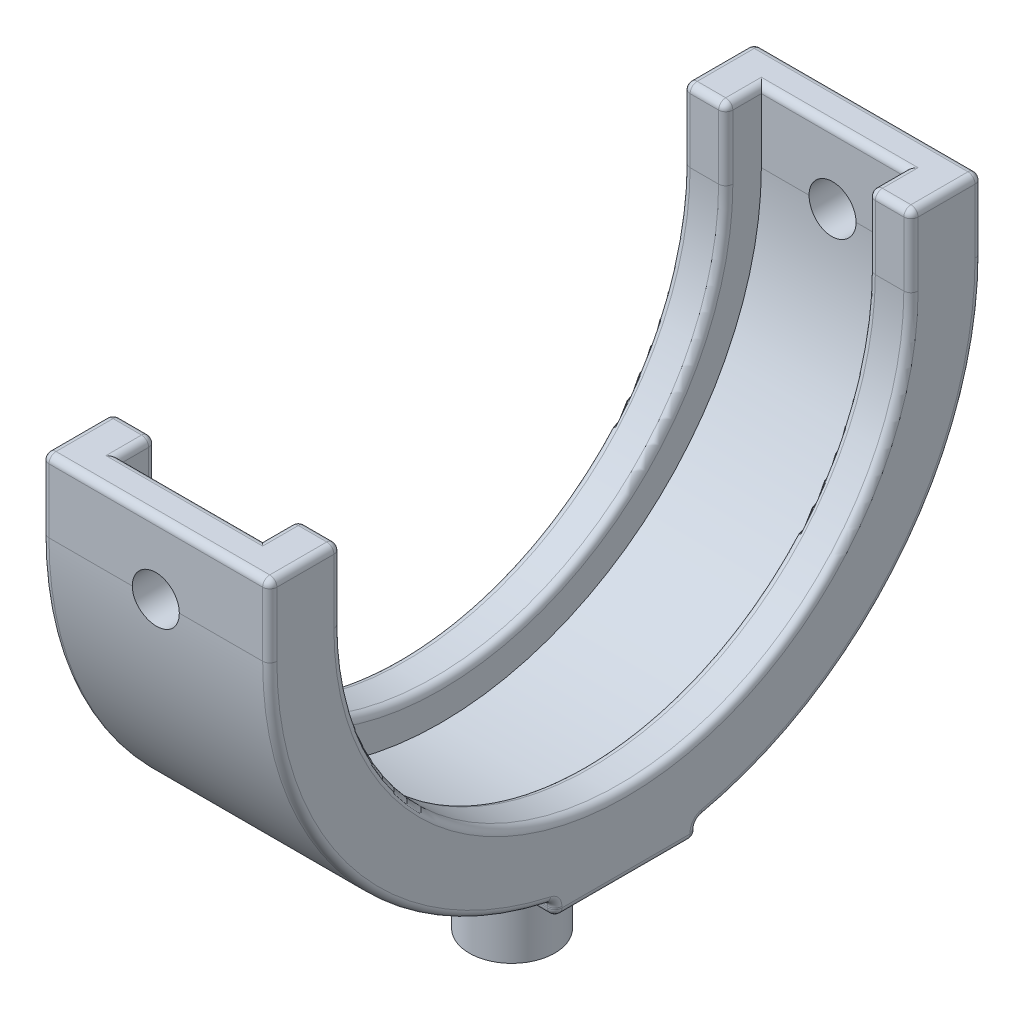
from build123d import *

# Parameters (mm, degrees)
BOSS_EXTRUDE1_DEPTH = 16
SKETCH4_R           = 2.999999999999999
BOSS_EXTRUDE2_DEPTH = 7
BOSS_EXTRUDE3_DEPTH = 5
SKETCH19_R          = 1.6500000000000006
CUT_EXTRUDE1_DEPTH  = 62.74073500409036
FILLET3_R           = 0.5
FILLET5_R           = 0.5
FILLET6_R           = 0.5


with BuildPart() as part:
    # Sketch1 → Boss-Extrude1 (new body)
    with BuildSketch(Plane(origin=(0, 0, 0), x_dir=(0, 0, -1), z_dir=(1, 0, 0))):
        with BuildLine():
            Line((-25, 0), (25, 0))
            ThreePointArc((25, 0), (19.364916731037084, -15.811388300841896), (4.999999999999999, -24.49489742783178))
            Line((4.999999999999999, -24.49489742783178), (5, -25.494897427831784))
            Line((5, -25.494897427831784), (-5, -25.494897427831784))
            Line((-5, -25.494897427831784), (-4.999999999999999, -24.49489742783178))
            ThreePointArc((-4.999999999999999, -24.49489742783178), (-19.364916731037088, -15.811388300841891), (-25, 0))
        make_face()
    extrude(amount=BOSS_EXTRUDE1_DEPTH)

    # Sketch2 → Cut-Revolve3 (revolve, cut)
    with BuildSketch(Plane(origin=(0, 0, 0), x_dir=(1, 0, 0), z_dir=(0, 1, 0))):
        Polygon((2.999999999999999, -22.5), (12.999999999999995, -22.5), (13.000000000000002, -20), (16, -20), (16, 0), (13.000000000000002, 0), (3, 0), (0, 0), (0, -20), (2.999999999999999, -20), align=None)
    revolve(axis=Axis((3, 0, 0), (1, 0, 0)), mode=Mode.SUBTRACT)

    # Sketch4 → Boss-Extrude2 (add)
    with BuildSketch(Plane.XZ.offset(25.494897427831784)):
        with Locations(Location((8, 0, 0), (0, 0, 270))):
            Circle(SKETCH4_R)
    extrude(amount=BOSS_EXTRUDE2_DEPTH)

    # Sketch18 → Boss-Extrude3 (add)
    with BuildSketch(Plane(origin=(0, 0, 0), x_dir=(1, 0, 0), z_dir=(0, 1, 0))):
        Polygon((16, -25), (16, -20), (13.000000000000002, -20), (12.999999999999995, -22.5), (2.999999999999999, -22.5), (2.999999999999999, -20), (0, -20), (0, -25), align=None)
        Polygon((12.999999999999995, 22.5), (13.000000000000002, 20), (16, 20), (16, 25), (0, 25), (0, 20), (2.999999999999999, 20), (2.999999999999999, 22.5), align=None)
    extrude(amount=BOSS_EXTRUDE3_DEPTH)

    # Sketch19 → Cut-Extrude1 (cut, through all)
    with BuildSketch(Plane.XY.offset(25)):
        with Locations((8, 0)):
            Circle(SKETCH19_R)
    extrude(amount=-CUT_EXTRUDE1_DEPTH, mode=Mode.SUBTRACT)

    # Fillet3
    fillet3_edges = [part.edges().sort_by_distance(p)[0] for p in [
        (8, -24.49489742783178, -5),
        (8, -25.494897427831784, -5),
        (8, -25.494897427831784, 5),
        (8, -24.49489742783178, 5),
        (16, -25.494897427831784, 0),
        (8, 5, 25),
        (16, 5, 22.5),
        (14.5, 5, 20),
        (12.999999999999998, 5, 21.25),
        (7.9999999999999964, 5, 22.5),
        (2.999999999999999, 5, 21.25),
        (1.4999999999999996, 5, 20),
        (0, 5, 22.5),
        (7.999999999999997, 5, -22.5),
        (12.999999999999998, 5, -21.25),
        (14.5, 5, -20),
        (16, 5, -22.5),
        (8, 5, -25),
        (0, 5, -22.5),
        (1.4999999999999996, 5, -20),
        (2.999999999999999, 5, -21.25),
        (0, -25.494897427831784, 0),
    ]]
    fillet(fillet3_edges, radius=FILLET3_R)

    # Fillet5
    # the kernel refuses this fillet: 0.5 mm, written as the material it takes off along each edge
    with BuildSketch(Plane(origin=(13.500000000000117, 4.5, 20.5), x_dir=(-1, 0, 2.84e-15), z_dir=(0, 0, -1))) as fillet5_piece_1_section:
        Polygon((0, 0), (FILLET5_R, 0), (FILLET5_R, FILLET5_R), (0, FILLET5_R), align=None)
    fillet5_piece_1 = extrude(amount=FILLET5_R, mode=Mode.PRIVATE)
    fillet5_piece_1 = fillet5_piece_1 - Plane(origin=(13.500000000000117, 4.5, 20.5), x_dir=(0.7071067811865475, -0.7071067811865475, -2.009718347115232e-15), z_dir=(0, 0, -1)) * Sphere(FILLET5_R, mode=Mode.PRIVATE)
    add(fillet5_piece_1, mode=Mode.SUBTRACT)
    with BuildSketch(Plane(origin=(15.5, 4.5, 20.5), x_dir=(0, 0, -1), z_dir=(1, 0, 0))) as fillet5_piece_2_section:
        Polygon((0, 0), (FILLET5_R, 0), (FILLET5_R, FILLET5_R), (0, FILLET5_R), align=None)
    fillet5_piece_2 = extrude(amount=FILLET5_R, mode=Mode.PRIVATE)
    fillet5_piece_2 = fillet5_piece_2 - Plane(origin=(15.5, 4.5, 20.5), x_dir=(0, -0.7071067811865475, 0.7071067811865475), z_dir=(1, 0, 0)) * Sphere(FILLET5_R, mode=Mode.PRIVATE)
    add(fillet5_piece_2, mode=Mode.SUBTRACT)
    with BuildSketch(Plane(origin=(2.499999999999999, 4.5, 20.5), x_dir=(1, 0, 0), z_dir=(0, 0, -1))) as fillet5_piece_3_section:
        Polygon((0, 0), (FILLET5_R, 0), (FILLET5_R, -FILLET5_R), (0, -FILLET5_R), align=None)
    fillet5_piece_3 = extrude(amount=FILLET5_R, mode=Mode.PRIVATE)
    fillet5_piece_3 = fillet5_piece_3 - Plane(origin=(2.499999999999999, 4.5, 20.5), x_dir=(-0.7071067811865475, -0.7071067811865475, 0), z_dir=(0, 0, -1)) * Sphere(FILLET5_R, mode=Mode.PRIVATE)
    add(fillet5_piece_3, mode=Mode.SUBTRACT)
    with BuildSketch(Plane(origin=(0.5, 4.5, 20.5), x_dir=(0, 0, -1), z_dir=(-1, 0, 0))) as fillet5_piece_4_section:
        Polygon((0, 0), (FILLET5_R, 0), (FILLET5_R, -FILLET5_R), (0, -FILLET5_R), align=None)
    fillet5_piece_4 = extrude(amount=FILLET5_R, mode=Mode.PRIVATE)
    fillet5_piece_4 = fillet5_piece_4 - Plane(origin=(0.5, 4.5, 20.5), x_dir=(0, -0.7071067811865475, 0.7071067811865475), z_dir=(-1, 0, 0)) * Sphere(FILLET5_R, mode=Mode.PRIVATE)
    add(fillet5_piece_4, mode=Mode.SUBTRACT)
    with BuildSketch(Plane(origin=(15.5, 4.5, -20.5), x_dir=(0, 0, 1), z_dir=(1, 0, 0))) as fillet5_piece_5_section:
        Polygon((0, 0), (FILLET5_R, 0), (FILLET5_R, -FILLET5_R), (0, -FILLET5_R), align=None)
    fillet5_piece_5 = extrude(amount=FILLET5_R, mode=Mode.PRIVATE)
    fillet5_piece_5 = fillet5_piece_5 - Plane(origin=(15.5, 4.5, -20.5), x_dir=(0, -0.7071067811865475, -0.7071067811865475), z_dir=(1, 0, 0)) * Sphere(FILLET5_R, mode=Mode.PRIVATE)
    add(fillet5_piece_5, mode=Mode.SUBTRACT)
    with BuildSketch(Plane(origin=(13.5, 4.5, -20.5), x_dir=(-1, 0, 2.84e-15), z_dir=(0, 0, 1))) as fillet5_piece_6_section:
        Polygon((0, 0), (FILLET5_R, 0), (FILLET5_R, -FILLET5_R), (0, -FILLET5_R), align=None)
    fillet5_piece_6 = extrude(amount=FILLET5_R, mode=Mode.PRIVATE)
    fillet5_piece_6 = fillet5_piece_6 - Plane(origin=(13.5, 4.5, -20.5), x_dir=(0.7071067811865475, -0.7071067811865475, -2.009718347115232e-15), z_dir=(0, 0, 1)) * Sphere(FILLET5_R, mode=Mode.PRIVATE)
    add(fillet5_piece_6, mode=Mode.SUBTRACT)
    with BuildSketch(Plane(origin=(0.5, 4.5, -20.5), x_dir=(0, 0, 1), z_dir=(-1, 0, 0))) as fillet5_piece_7_section:
        Polygon((0, 0), (FILLET5_R, 0), (FILLET5_R, FILLET5_R), (0, FILLET5_R), align=None)
    fillet5_piece_7 = extrude(amount=FILLET5_R, mode=Mode.PRIVATE)
    fillet5_piece_7 = fillet5_piece_7 - Plane(origin=(0.5, 4.5, -20.5), x_dir=(0, -0.7071067811865475, -0.7071067811865475), z_dir=(-1, 0, 0)) * Sphere(FILLET5_R, mode=Mode.PRIVATE)
    add(fillet5_piece_7, mode=Mode.SUBTRACT)
    with BuildSketch(Plane(origin=(2.499999999999999, 4.5, -20.5), x_dir=(1, 0, 0), z_dir=(0, 0, 1))) as fillet5_piece_8_section:
        Polygon((0, 0), (FILLET5_R, 0), (FILLET5_R, FILLET5_R), (0, FILLET5_R), align=None)
    fillet5_piece_8 = extrude(amount=FILLET5_R, mode=Mode.PRIVATE)
    fillet5_piece_8 = fillet5_piece_8 - Plane(origin=(2.499999999999999, 4.5, -20.5), x_dir=(-0.7071067811865475, -0.7071067811865475, 0), z_dir=(0, 0, 1)) * Sphere(FILLET5_R, mode=Mode.PRIVATE)
    add(fillet5_piece_8, mode=Mode.SUBTRACT)
    with BuildSketch(Plane(origin=(0, 0, 20), x_dir=(0, 0, 1), z_dir=(0, 1, 0))) as fillet5_piece_9:
        with BuildLine():
            CenterArc((FILLET5_R, FILLET5_R), FILLET5_R, 180, 90)
            Line((0, FILLET5_R), (0, 0))
            Line((0, 0), (FILLET5_R, 0))
        make_face()
    extrude(amount=4.5, mode=Mode.SUBTRACT)
    with BuildSketch(Plane(origin=(0, 0, -20), x_dir=(0, 0, -1), z_dir=(0, 1, 0))) as fillet5_piece_10:
        with BuildLine():
            CenterArc((FILLET5_R, -FILLET5_R), FILLET5_R, 90, 90)
            Line((0, -FILLET5_R), (0, 0))
            Line((0, 0), (FILLET5_R, 0))
        make_face()
    extrude(amount=4.5, mode=Mode.SUBTRACT)
    with BuildSketch(Plane(origin=(2.999999999999999, 0, 20), x_dir=(-1, 0, 0), z_dir=(0, 1, 0))) as fillet5_piece_11:
        with BuildLine():
            CenterArc((FILLET5_R, FILLET5_R), FILLET5_R, 180, 90)
            Line((0, FILLET5_R), (0, 0))
            Line((0, 0), (FILLET5_R, 0))
        make_face()
    extrude(amount=4.5, mode=Mode.SUBTRACT)
    with BuildSketch(Plane(origin=(2.999999999999999, 0, -20), x_dir=(-1, 0, 0), z_dir=(0, 1, 0))) as fillet5_piece_12:
        with BuildLine():
            CenterArc((FILLET5_R, -FILLET5_R), FILLET5_R, 90, 90)
            Line((0, -FILLET5_R), (0, 0))
            Line((0, 0), (FILLET5_R, 0))
        make_face()
    extrude(amount=4.5, mode=Mode.SUBTRACT)
    with BuildSketch(Plane(origin=(13.000000000000002, 0, 20), x_dir=(1, 0, 0), z_dir=(0, 1, 0))) as fillet5_piece_13:
        with BuildLine():
            CenterArc((FILLET5_R, -FILLET5_R), FILLET5_R, 90, 90)
            Line((1.78e-15, -FILLET5_R), (0, 0))
            Line((0, 0), (FILLET5_R, 0))
        make_face()
    extrude(amount=4.5, mode=Mode.SUBTRACT)
    with BuildSketch(Plane(origin=(13.000000000000002, 0, -20), x_dir=(1, 0, 0), z_dir=(0, 1, 0))) as fillet5_piece_14:
        with BuildLine():
            CenterArc((FILLET5_R, FILLET5_R), FILLET5_R, 180, 90)
            Line((-1.78e-15, FILLET5_R), (0, 0))
            Line((0, 0), (FILLET5_R, 0))
        make_face()
    extrude(amount=4.5, mode=Mode.SUBTRACT)
    with BuildSketch(Plane(origin=(16, 0, 20), x_dir=(0, 0, 1), z_dir=(0, 1, 0))) as fillet5_piece_15:
        with BuildLine():
            CenterArc((FILLET5_R, -FILLET5_R), FILLET5_R, 90, 90)
            Line((0, -FILLET5_R), (0, 0))
            Line((0, 0), (FILLET5_R, 0))
        make_face()
    extrude(amount=4.5, mode=Mode.SUBTRACT)
    with BuildSketch(Plane(origin=(16, 0, -20), x_dir=(0, 0, -1), z_dir=(0, 1, 0))) as fillet5_piece_16:
        with BuildLine():
            CenterArc((FILLET5_R, FILLET5_R), FILLET5_R, 180, 90)
            Line((0, FILLET5_R), (0, 0))
            Line((0, 0), (FILLET5_R, 0))
        make_face()
    extrude(amount=4.5, mode=Mode.SUBTRACT)
    with BuildSketch(Plane(origin=(0, 0, 0), x_dir=(0, 0, 1), z_dir=(0, 1, 0))) as fillet5_piece_17:
        with BuildLine():
            CenterArc((20 + FILLET5_R, FILLET5_R), FILLET5_R, 180, 90)
            Line((20, FILLET5_R), (20, 0))
            Line((20, 0), (20 + FILLET5_R, 0))
        make_face()
    revolve(axis=Axis((0, 0, 0), (1, 0, 0)), revolution_arc=180, mode=Mode.SUBTRACT)
    with BuildSketch(Plane(origin=(16, 0, 0), x_dir=(0, 0, 1), z_dir=(0, 1, 0))) as fillet5_piece_18:
        with BuildLine():
            CenterArc((20 + FILLET5_R, -FILLET5_R), FILLET5_R, 90, 90)
            Line((20, -FILLET5_R), (20, 0))
            Line((20, 0), (20 + FILLET5_R, 0))
        make_face()
    revolve(axis=Axis((16, 0, 0), (1, 0, 0)), revolution_arc=180, mode=Mode.SUBTRACT)
    with BuildSketch(Plane(origin=(13.000000000000002, 0, 0), x_dir=(0, 0, 1), z_dir=(0, 1, 0))) as fillet5_piece_19:
        with BuildLine():
            CenterArc((20 + FILLET5_R, FILLET5_R), FILLET5_R, 180, 90)
            Line((20 + FILLET5_R, 1.78e-15), (20, 0))
            Line((20, 0), (20, FILLET5_R))
        make_face()
    revolve(axis=Axis((13.000000000000002, 0, 0), (1, 0, 0)), revolution_arc=180, mode=Mode.SUBTRACT)
    with BuildSketch(Plane(origin=(2.999999999999999, 0, 0), x_dir=(0, 0, 1), z_dir=(0, 1, 0))) as fillet5_piece_20:
        with BuildLine():
            CenterArc((20 + FILLET5_R, -FILLET5_R), FILLET5_R, 90, 90)
            Line((20 + FILLET5_R, 0), (20, 0))
            Line((20, 0), (20, -FILLET5_R))
        make_face()
    revolve(axis=Axis((2.999999999999999, 0, 0), (1, 0, 0)), revolution_arc=180, mode=Mode.SUBTRACT)

    # Fillet6
    # the kernel refuses this fillet: 0.5 mm, written as the material it takes off along each edge
    with BuildSketch(Plane(origin=(15.5, 4.5, 24.5), x_dir=(1, 0, 0), z_dir=(0, 0, 1))) as fillet6_piece_1_section:
        Polygon((0, 0), (FILLET6_R, 0), (FILLET6_R, FILLET6_R), (0, FILLET6_R), align=None)
    fillet6_piece_1 = extrude(amount=FILLET6_R, mode=Mode.PRIVATE)
    fillet6_piece_1 = fillet6_piece_1 - Plane(origin=(15.5, 4.5, 24.5), x_dir=(-0.7071067811865475, -0.7071067811865475, 0), z_dir=(0, 0, 1)) * Sphere(FILLET6_R, mode=Mode.PRIVATE)
    add(fillet6_piece_1, mode=Mode.SUBTRACT)
    with BuildSketch(Plane(origin=(0.5, 4.5, 24.5), x_dir=(0, 0, 1), z_dir=(-1, 0, 0))) as fillet6_piece_2_section:
        Polygon((0, 0), (FILLET6_R, 0), (FILLET6_R, FILLET6_R), (0, FILLET6_R), align=None)
    fillet6_piece_2 = extrude(amount=FILLET6_R, mode=Mode.PRIVATE)
    fillet6_piece_2 = fillet6_piece_2 - Plane(origin=(0.5, 4.5, 24.5), x_dir=(0, -0.7071067811865475, -0.7071067811865475), z_dir=(-1, 0, 0)) * Sphere(FILLET6_R, mode=Mode.PRIVATE)
    add(fillet6_piece_2, mode=Mode.SUBTRACT)
    with BuildSketch(Plane(origin=(15.5, 4.5, -24.5), x_dir=(1, 0, 0), z_dir=(0, 0, -1))) as fillet6_piece_3_section:
        Polygon((0, 0), (FILLET6_R, 0), (FILLET6_R, -FILLET6_R), (0, -FILLET6_R), align=None)
    fillet6_piece_3 = extrude(amount=FILLET6_R, mode=Mode.PRIVATE)
    fillet6_piece_3 = fillet6_piece_3 - Plane(origin=(15.5, 4.5, -24.5), x_dir=(-0.7071067811865475, -0.7071067811865475, 0), z_dir=(0, 0, -1)) * Sphere(FILLET6_R, mode=Mode.PRIVATE)
    add(fillet6_piece_3, mode=Mode.SUBTRACT)
    with BuildSketch(Plane(origin=(0.5, 4.5, -24.5), x_dir=(0, 0, -1), z_dir=(-1, 0, 0))) as fillet6_piece_4_section:
        Polygon((0, 0), (FILLET6_R, 0), (FILLET6_R, -FILLET6_R), (0, -FILLET6_R), align=None)
    fillet6_piece_4 = extrude(amount=FILLET6_R, mode=Mode.PRIVATE)
    fillet6_piece_4 = fillet6_piece_4 - Plane(origin=(0.5, 4.5, -24.5), x_dir=(0, -0.7071067811865475, 0.7071067811865475), z_dir=(-1, 0, 0)) * Sphere(FILLET6_R, mode=Mode.PRIVATE)
    add(fillet6_piece_4, mode=Mode.SUBTRACT)
    with BuildSketch(Plane(origin=(0.5, -24.994897427831784, 4.5), x_dir=(0, 8.9e-16, 1), z_dir=(-1, 0, 0))) as fillet6_piece_5_section:
        Polygon((0, 0), (FILLET6_R, 0), (FILLET6_R, -FILLET6_R), (-4.4e-16, -FILLET6_R), align=None)
    fillet6_piece_5 = extrude(amount=FILLET6_R, mode=Mode.PRIVATE)
    fillet6_piece_5 = fillet6_piece_5 - Plane(origin=(0.5, -24.994897427831784, 4.5), x_dir=(0, 0.7071067811865471, -0.7071067811865478), z_dir=(-1, 0, 0)) * Sphere(FILLET6_R, mode=Mode.PRIVATE)
    add(fillet6_piece_5, mode=Mode.SUBTRACT)
    with BuildSketch(Plane(origin=(0.5, -24.994897427831784, -4.499999999999999), x_dir=(0, 8.9e-16, -1), z_dir=(-1, 0, 0))) as fillet6_piece_6_section:
        Polygon((0, 0), (FILLET6_R, 0), (FILLET6_R, FILLET6_R), (-4.4e-16, FILLET6_R), align=None)
    fillet6_piece_6 = extrude(amount=FILLET6_R, mode=Mode.PRIVATE)
    fillet6_piece_6 = fillet6_piece_6 - Plane(origin=(0.5, -24.994897427831784, -4.499999999999999), x_dir=(0, 0.7071067811865471, 0.7071067811865478), z_dir=(-1, 0, 0)) * Sphere(FILLET6_R, mode=Mode.PRIVATE)
    add(fillet6_piece_6, mode=Mode.SUBTRACT)
    with BuildSketch(Plane(origin=(15.5, -24.994897427831784, 4.5), x_dir=(1, 0, 0), z_dir=(0, 8.9e-16, 1))) as fillet6_piece_7_section:
        Polygon((0, 0), (FILLET6_R, 0), (FILLET6_R, -FILLET6_R), (0, -FILLET6_R), align=None)
    fillet6_piece_7 = extrude(amount=FILLET6_R, mode=Mode.PRIVATE)
    fillet6_piece_7 = fillet6_piece_7 - Plane(origin=(15.5, -24.994897427831784, 4.5), x_dir=(-0.7071067811865475, 0.7071067811865475, 0), z_dir=(0, 8.9e-16, 1)) * Sphere(FILLET6_R, mode=Mode.PRIVATE)
    add(fillet6_piece_7, mode=Mode.SUBTRACT)
    with BuildSketch(Plane(origin=(15.5, -24.994897427831784, -4.5), x_dir=(1, 0, 0), z_dir=(0, 8.9e-16, -1))) as fillet6_piece_8_section:
        Polygon((0, 0), (FILLET6_R, 0), (FILLET6_R, FILLET6_R), (0, FILLET6_R), align=None)
    fillet6_piece_8 = extrude(amount=FILLET6_R, mode=Mode.PRIVATE)
    fillet6_piece_8 = fillet6_piece_8 - Plane(origin=(15.5, -24.994897427831784, -4.5), x_dir=(-0.7071067811865475, 0.7071067811865475, 0), z_dir=(0, 8.9e-16, -1)) * Sphere(FILLET6_R, mode=Mode.PRIVATE)
    add(fillet6_piece_8, mode=Mode.SUBTRACT)
    with BuildSketch(Plane(origin=(0, 0, 25), x_dir=(0, 0, -1), z_dir=(0, 1, 0))) as fillet6_piece_9:
        with BuildLine():
            CenterArc((FILLET6_R, -FILLET6_R), FILLET6_R, 90, 90)
            Line((0, -FILLET6_R), (0, 0))
            Line((0, 0), (FILLET6_R, 0))
        make_face()
    extrude(amount=4.5, mode=Mode.SUBTRACT)
    with BuildSketch(Plane(origin=(0, 0, -25), x_dir=(0, 0, 1), z_dir=(0, 1, 0))) as fillet6_piece_10:
        with BuildLine():
            CenterArc((FILLET6_R, FILLET6_R), FILLET6_R, 180, 90)
            Line((0, FILLET6_R), (0, 0))
            Line((0, 0), (FILLET6_R, 0))
        make_face()
    extrude(amount=4.5, mode=Mode.SUBTRACT)
    with BuildSketch(Plane(origin=(0, 3.55e-15, 5.33e-15), x_dir=(0, -1.4e-16, -1), z_dir=(0, 1, -1.4e-16))) as fillet6_piece_11:
        with BuildLine():
            CenterArc((25.000000000000007 - FILLET6_R, -FILLET6_R), FILLET6_R, 6.36e-15, 90)
            Line((25.000000000000007, -FILLET6_R), (25.000000000000007, 0))
            Line((25.000000000000007, 0), (25.000000000000007 - FILLET6_R, 0))
        make_face()
    revolve(axis=Axis((0, 3.55e-15, 5.33e-15), (-1, 0, 0)), revolution_arc=77.54420737409465, mode=Mode.SUBTRACT)
    with BuildSketch(Plane(origin=(0, -24.899799195977465, -4.999999999999999), x_dir=(0, -8.9e-16, 1), z_dir=(0, -1, -8.9e-16))) as fillet6_piece_12:
        with BuildLine():
            CenterArc((FILLET6_R, -FILLET6_R), FILLET6_R, 90, 90)
            Line((0, -FILLET6_R), (0, 0))
            Line((0, 0), (FILLET6_R, 0))
        make_face()
    extrude(amount=0.09509823185431898, mode=Mode.SUBTRACT)
    with BuildSketch(Plane(origin=(0, -24.994897427831784, 5), x_dir=(0, -8.9e-16, -1), z_dir=(0, 1, -8.9e-16))) as fillet6_piece_13:
        with BuildLine():
            CenterArc((FILLET6_R, -FILLET6_R), FILLET6_R, 90, 90)
            Line((0, -FILLET6_R), (0, 0))
            Line((0, 0), (FILLET6_R, 0))
        make_face()
    extrude(amount=0.09509823185432253, mode=Mode.SUBTRACT)
    with BuildSketch(Plane(origin=(16, 0, 25), x_dir=(-1, 0, 0), z_dir=(0, 1, 0))) as fillet6_piece_14:
        with BuildLine():
            CenterArc((FILLET6_R, -FILLET6_R), FILLET6_R, 90, 90)
            Line((0, -FILLET6_R), (0, 0))
            Line((0, 0), (FILLET6_R, 0))
        make_face()
    extrude(amount=4.5, mode=Mode.SUBTRACT)
    with BuildSketch(Plane(origin=(16, -24.994897427831784, 5), x_dir=(-1, 0, 0), z_dir=(0, 1, -8.9e-16))) as fillet6_piece_15:
        with BuildLine():
            CenterArc((FILLET6_R, -FILLET6_R), FILLET6_R, 90, 90)
            Line((0, -FILLET6_R), (0, 0))
            Line((0, 0), (FILLET6_R, 0))
        make_face()
    extrude(amount=0.09509823185432253, mode=Mode.SUBTRACT)
    with BuildSketch(Plane(origin=(16, -24.899799195977465, -4.999999999999999), x_dir=(-1, 0, 0), z_dir=(0, -1, -8.9e-16))) as fillet6_piece_16:
        with BuildLine():
            CenterArc((FILLET6_R, -FILLET6_R), FILLET6_R, 90, 90)
            Line((0, -FILLET6_R), (0, 0))
            Line((0, 0), (FILLET6_R, 0))
        make_face()
    extrude(amount=0.09509823185431898, mode=Mode.SUBTRACT)
    with BuildSketch(Plane(origin=(16, 3.55e-15, 5.33e-15), x_dir=(0, -1.4e-16, -1), z_dir=(0, 1, -1.4e-16))) as fillet6_piece_17:
        with BuildLine():
            CenterArc((25.000000000000007 - FILLET6_R, FILLET6_R), FILLET6_R, 270, 90)
            Line((25.000000000000007 - FILLET6_R, 0), (25.000000000000007, 0))
            Line((25.000000000000007, 0), (25.000000000000007, FILLET6_R))
        make_face()
    revolve(axis=Axis((16, 3.55e-15, 5.33e-15), (-1, 0, 0)), revolution_arc=77.54420737409465, mode=Mode.SUBTRACT)
    with BuildSketch(Plane(origin=(16, 0, -25), x_dir=(-1, 0, 0), z_dir=(0, 1, 0))) as fillet6_piece_18:
        with BuildLine():
            CenterArc((FILLET6_R, FILLET6_R), FILLET6_R, 180, 90)
            Line((0, FILLET6_R), (0, 0))
            Line((0, 0), (FILLET6_R, 0))
        make_face()
    extrude(amount=4.5, mode=Mode.SUBTRACT)
    with BuildSketch(Plane(origin=(0, -24.899799195977465, 5.5), x_dir=(0, 0.9764627135677445, -0.21568627450980027), z_dir=(0, 0.21568627450980027, 0.9764627135677445))) as fillet6_piece_19:
        with BuildLine():
            CenterArc((0.49999999999999845 + FILLET6_R, -FILLET6_R), FILLET6_R, 90, 90)
            Line((0.4999999999999982, -FILLET6_R), (0.49999999999999845, 0))
            Line((0.49999999999999845, 0), (0.49999999999999845 + FILLET6_R, 0))
        make_face()
    revolve(axis=Axis((0, -24.899799195977465, 5.5), (-1, 0, 0)), revolution_arc=77.54420737409448, mode=Mode.SUBTRACT)
    with BuildSketch(Plane(origin=(16, -24.899799195977465, 5.5), x_dir=(0, 0.9764627135677445, -0.21568627450980027), z_dir=(0, 0.21568627450980027, 0.9764627135677445))) as fillet6_piece_20:
        with BuildLine():
            CenterArc((0.49999999999999845 + FILLET6_R, FILLET6_R), FILLET6_R, 180, 89.9999999999996)
            Line((0.49999999999999845 + FILLET6_R, 0), (0.49999999999999845, 0))
            Line((0.49999999999999845, 0), (0.4999999999999982, FILLET6_R))
        make_face()
    revolve(axis=Axis((16, -24.899799195977465, 5.5), (-1, 0, 0)), revolution_arc=77.54420737409448, mode=Mode.SUBTRACT)
    with BuildSketch(Plane(origin=(0, -24.899799195977465, -5.5), x_dir=(0, 0.9764627135677431, 0.21568627450980704), z_dir=(0, 0.21568627450980704, -0.9764627135677431))) as fillet6_piece_21:
        with BuildLine():
            CenterArc((0.4999999999999993 + FILLET6_R, FILLET6_R), FILLET6_R, 180, 90)
            Line((0.49999999999999944, FILLET6_R), (0.4999999999999993, 0))
            Line((0.4999999999999993, 0), (0.4999999999999993 + FILLET6_R, 0))
        make_face()
    revolve(axis=Axis((0, -24.899799195977465, -5.5), (1, 0, 0)), revolution_arc=77.54420737409448, mode=Mode.SUBTRACT)
    with BuildSketch(Plane(origin=(16, -24.899799195977465, -5.5), x_dir=(0, 0.9764627135677431, 0.21568627450980704), z_dir=(0, 0.21568627450980704, -0.9764627135677431))) as fillet6_piece_22:
        with BuildLine():
            CenterArc((0.4999999999999993 + FILLET6_R, -FILLET6_R), FILLET6_R, 90.00000000000003, 90)
            Line((0.4999999999999993 + FILLET6_R, 0), (0.4999999999999993, 0))
            Line((0.4999999999999993, 0), (0.49999999999999944, -FILLET6_R))
        make_face()
    revolve(axis=Axis((16, -24.899799195977465, -5.5), (1, 0, 0)), revolution_arc=77.54420737409448, mode=Mode.SUBTRACT)
    with BuildSketch(Plane(origin=(16, 0, 8.9e-16), x_dir=(0, -0.9764627135677437, 0.21568627450980396), z_dir=(0, -0.21568627450980396, -0.9764627135677437))) as fillet6_piece_23:
        with BuildLine():
            CenterArc((25.000000000000004 - FILLET6_R, FILLET6_R), FILLET6_R, 270, 90)
            Line((25.000000000000004 - FILLET6_R, 0), (25.000000000000004, 0))
            Line((25.000000000000004, 0), (25.000000000000004, FILLET6_R))
        make_face()
    revolve(axis=Axis((16, 0, 8.9e-16), (-1, 0, 0)), revolution_arc=77.54420737409467, mode=Mode.SUBTRACT)
    with BuildSketch(Plane(origin=(0, 0, 8.9e-16), x_dir=(0, -0.9764627135677437, 0.21568627450980396), z_dir=(0, -0.21568627450980396, -0.9764627135677437))) as fillet6_piece_24:
        with BuildLine():
            CenterArc((25.000000000000004 - FILLET6_R, -FILLET6_R), FILLET6_R, 6.36e-15, 90)
            Line((25.000000000000004, -FILLET6_R), (25.000000000000004, 0))
            Line((25.000000000000004, 0), (25.000000000000004 - FILLET6_R, 0))
        make_face()
    revolve(axis=Axis((0, 0, 8.9e-16), (-1, 0, 0)), revolution_arc=77.54420737409467, mode=Mode.SUBTRACT)


solid = part.part
